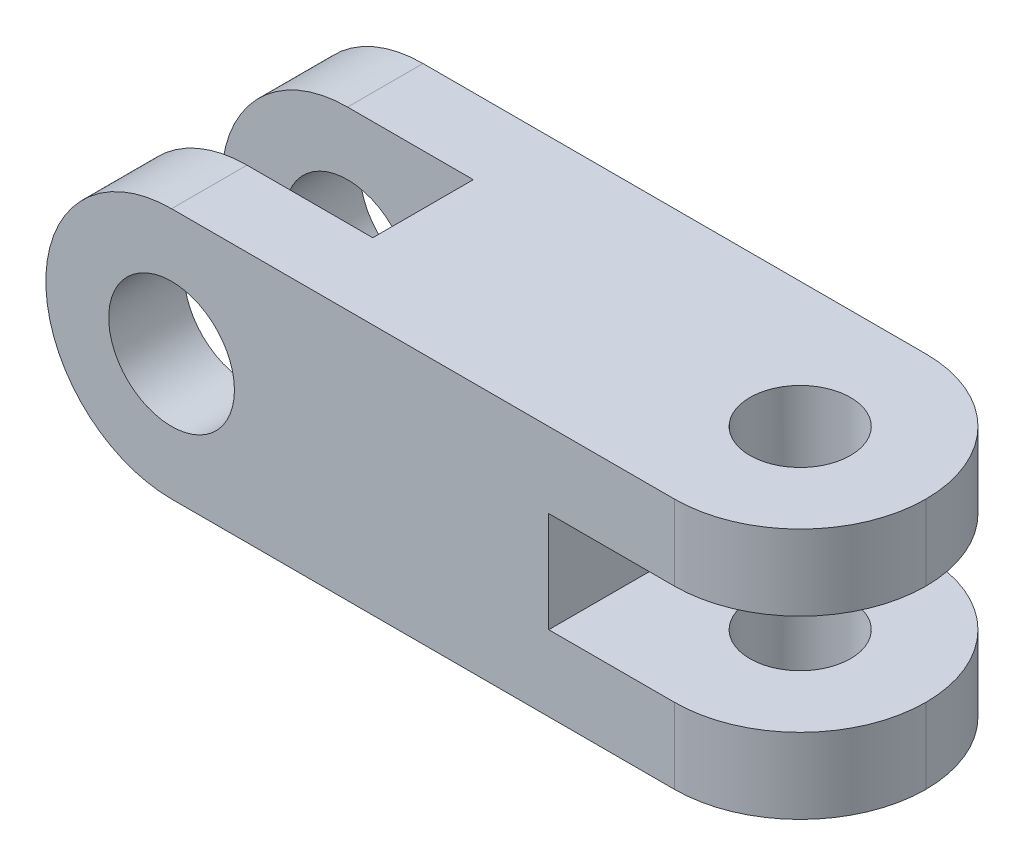
from build123d import *

# Parameters (mm, degrees)
SKETCH1_R           = 12.5
BOSS_EXTRUDE1_DEPTH = 50
FILLET1_R           = 25
SKETCH2_R           = 10
SKETCH2_W           = 50
SKETCH2_H           = 20
CUT_EXTRUDE1_DEPTH  = 55


with BuildPart() as part:
    # Sketch1 → Boss-Extrude1 (new body)
    with BuildSketch(Plane.XY):
        with BuildLine():
            ThreePointArc((0, 50), (-25, 25), (0, 0))
            Line((0, 0), (125, 0))
            Line((125, 0), (125, 15))
            Line((125, 15), (75, 15))
            Line((75, 15), (75, 35))
            Line((75, 35), (125, 35))
            Line((125, 35), (125, 50))
            Line((125, 50), (0, 50))
        make_face()
        with Locations((0, 25)):
            Circle(SKETCH1_R, mode=Mode.SUBTRACT)
    extrude(amount=BOSS_EXTRUDE1_DEPTH)

    # Fillet1
    fillet1_edges = [part.edges().sort_by_distance(p)[0] for p in [
        (125, 7.5, 0),
        (125, 42.5, 0),
        (125, 7.5, 50),
        (125, 42.5, 50),
    ]]
    fillet(fillet1_edges, radius=FILLET1_R - 0.0001)  # a hair under: the kernel refuses the full size

    # Sketch2 → Cut-Extrude1 (cut)
    with BuildSketch(Plane(origin=(0, 50, 0), x_dir=(1, 0, 0), z_dir=(0, 1, 0))):
        with Locations(Location((100, -25, 0), (0, 0, 270))):
            Circle(SKETCH2_R)
        with Locations((0, -25)):
            Rectangle(SKETCH2_W, SKETCH2_H)
    extrude(amount=-CUT_EXTRUDE1_DEPTH, mode=Mode.SUBTRACT)


solid = part.part
